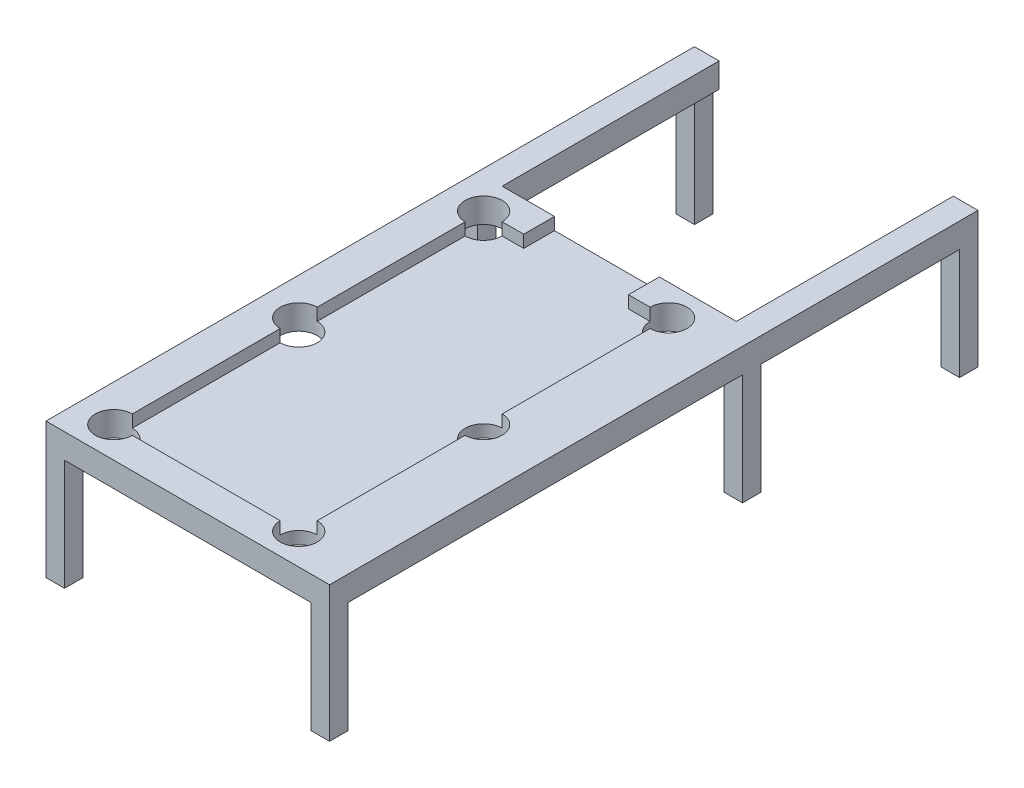
from build123d import *

# Parameters (mm, degrees)
SKETCH2_W           = 460
SKETCH2_H           = 700
SKETCH2_W_2         = 300
SKETCH2_H_2         = 600
BOSS_EXTRUDE1_DEPTH = 20
SKETCH10_W          = 460
SKETCH10_H          = 700
BOSS_EXTRUDE6_DEPTH = 20
SKETCH11_W          = 30
SKETCH11_H          = 30
BOSS_EXTRUDE7_DEPTH = 180
SKETCH14_W          = 40
SKETCH14_H          = 352
BOSS_EXTRUDE8_DEPTH = 40
SKETCH15_W          = 30
SKETCH15_H          = 30
BOSS_EXTRUDE9_DEPTH = 180
SKETCH17_R          = 30
CUT_EXTRUDE1_DEPTH  = 60
CUT_EXTRUDE2_DEPTH  = 20


with BuildPart() as part:
    # Sketch2 → Boss-Extrude1 (new body)
    with BuildSketch(Plane(origin=(0, 0, 0), x_dir=(1, 0, 0), z_dir=(0, 1, 0))):
        with Locations((230, 350)):
            Rectangle(SKETCH2_W, SKETCH2_H)
        with Locations((210, 350)):
            Rectangle(SKETCH2_W_2, SKETCH2_H_2, mode=Mode.SUBTRACT)
    extrude(amount=BOSS_EXTRUDE1_DEPTH)

    # Sketch10 → Boss-Extrude6 (add)
    with BuildSketch(Plane.XZ):
        with Locations((230, -350)):
            Rectangle(SKETCH10_W, SKETCH10_H)
    extrude(amount=BOSS_EXTRUDE6_DEPTH)

    # Sketch11 → Boss-Extrude7 (add)
    with BuildSketch(Plane.XZ.offset(20)):
        with Locations((15, -15)):
            Rectangle(SKETCH11_W, SKETCH11_H)
        with Locations((445, -15)):
            Rectangle(SKETCH11_W, SKETCH11_H)
        with Locations((15, -685)):
            Rectangle(SKETCH11_W, SKETCH11_H)
        with Locations((445, -685)):
            Rectangle(SKETCH11_W, SKETCH11_H)
    extrude(amount=BOSS_EXTRUDE7_DEPTH)

    # Sketch14 → Boss-Extrude8 (add)
    with BuildSketch(Plane(origin=(0, 20, 0), x_dir=(1, 0, 0), z_dir=(0, 1, 0))):
        with Locations((20, 876)):
            Rectangle(SKETCH14_W, SKETCH14_H)
        with Locations((440, 876)):
            Rectangle(SKETCH14_W, SKETCH14_H)
    extrude(amount=-BOSS_EXTRUDE8_DEPTH)

    # Sketch15 → Boss-Extrude9 (add)
    with BuildSketch(Plane.XZ.offset(20)):
        with Locations((445, -1037)):
            Rectangle(SKETCH15_W, SKETCH15_H)
        with Locations((15, -1037)):
            Rectangle(SKETCH15_W, SKETCH15_H)
    extrude(amount=BOSS_EXTRUDE9_DEPTH)

    # Sketch17 → Cut-Extrude1 (cut)
    with BuildSketch(Plane(origin=(0, 20, 0), x_dir=(1, 0, 0), z_dir=(0, 1, 0))):
        with Locations((60, 650)):
            Circle(SKETCH17_R)
        with Locations((360, 650)):
            Circle(SKETCH17_R)
        with Locations((60, 350)):
            Circle(SKETCH17_R)
        with Locations((360, 350)):
            Circle(SKETCH17_R)
        with Locations((60, 50)):
            Circle(SKETCH17_R)
        with Locations((360, 50)):
            Circle(SKETCH17_R)
    extrude(amount=-CUT_EXTRUDE1_DEPTH, mode=Mode.SUBTRACT)

    # Sketch18 → Cut-Extrude2 (cut)
    with BuildSketch(Plane(origin=(0, 20, 0), x_dir=(1, 0, 0), z_dir=(0, 1, 0))):
        Polygon((210, 700), (295, 700), (295, 650), (210, 650), (125, 650), (125, 700), align=None)
    extrude(amount=-CUT_EXTRUDE2_DEPTH, mode=Mode.SUBTRACT)


solid = part.part
